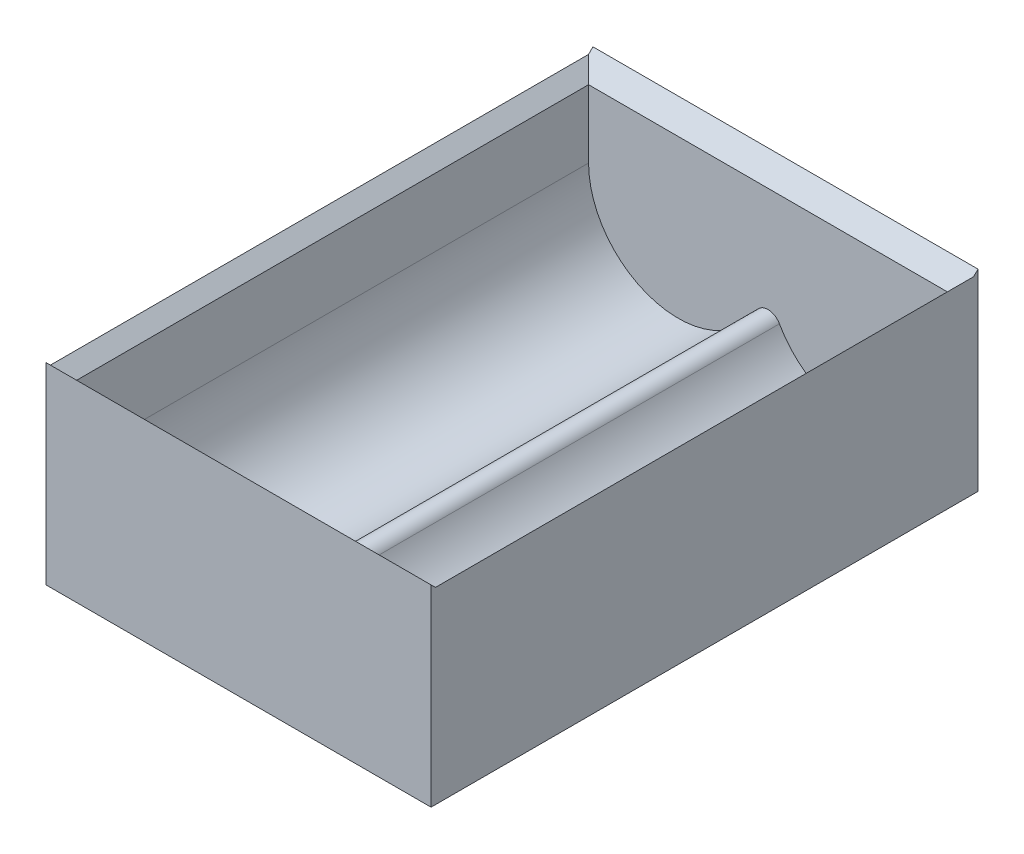
from build123d import *

# Parameters (mm, degrees)
SKETCH1_W           = 88
SKETCH1_H           = 125
BOSS_EXTRUDE1_DEPTH = 50
CUT_EXTRUDE1_DEPTH  = 117
FILLET1_R           = 3


with BuildPart() as part:
    # Sketch1 → Boss-Extrude1 (new body)
    with BuildSketch(Plane(origin=(0, 0, 0), x_dir=(1, 0, 0), z_dir=(0, 1, 0))):
        Rectangle(SKETCH1_W, SKETCH1_H)
    extrude(amount=BOSS_EXTRUDE1_DEPTH)

    # Sketch2 → Cut-Extrude1 (cut)
    with BuildSketch(Plane.XY.offset(58.5)):
        with BuildLine():
            Line((-41, 24.5), (-41, 66.5))
            Line((-41, 66.5), (41, 66.5))
            Line((41, 66.5), (41, 24.5))
            ThreePointArc((41, 24.5), (20.5, 4), (0, 24.5))
            ThreePointArc((0, 24.5), (-20.5, 4), (-41, 24.5))
        make_face()
    extrude(amount=-CUT_EXTRUDE1_DEPTH, mode=Mode.SUBTRACT)

    # Fillet1
    fillet1_edges = [part.edges().sort_by_distance(p)[0] for p in [
        (0, 24.5, 0),
    ]]
    fillet(fillet1_edges, radius=FILLET1_R)

    # Chamfer1
    # the kernel refuses this chamfer: 10 mm, written as the material it takes off along each edge
    with BuildSketch(Plane(origin=(-41, 50, 58.5), x_dir=(0, 0.027495876610586337, 0.9996219169112968), z_dir=(1, 0, 0)), Plane(origin=(-41, 50, -58.5), x_dir=(0, -0.9996219169112968, 0.027495876610586317), z_dir=(1, 0, 0))) as chamfer1_piece_1:
        with BuildLine():
            Line((10.286731952, 0), (-0.565471549, 10.271177935))
            Line((-0.565471549, 10.271177935), (-0.765395932, 10.26567876))
            ThreePointArc((-0.765395932, 10.26567876), (-0.341292271, 5.133978296), (-0.199924383, -0.005499175))
            Line((-0.199924383, -0.005499175), (0.005499175, -0.199924383))
            ThreePointArc((0.005499175, -0.199924383), (5.144976647, -0.058556496), (10.292231127, -0.199924383))
            Line((10.292231127, -0.199924383), (10.286731952, 0))
        make_face()
    extrude(amount=82, mode=Mode.SUBTRACT)
    with BuildSketch(Plane(origin=(41, 50, 58.5), x_dir=(0.9996219169112968, 0.027495876610586317, 0), z_dir=(0, 0, -1))) as chamfer1_piece_2:
        with BuildLine():
            Line((10.286731952, 0), (-0.565471549, 10.271177935))
            Line((-0.565471549, 10.271177935), (-0.765395932, 10.26567876))
            ThreePointArc((-0.765395932, 10.26567876), (-0.341292271, 5.133978296), (-0.199924383, -0.005499175))
            Line((-0.199924383, -0.005499175), (0.005499175, -0.199924383))
            ThreePointArc((0.005499175, -0.199924383), (5.144976647, -0.058556496), (10.292231127, -0.199924383))
            Line((10.292231127, -0.199924383), (10.286731952, 0))
        make_face()
    extrude(amount=117, mode=Mode.SUBTRACT)
    with BuildSketch(Plane(origin=(-41, 50, -58.5), x_dir=(0.027495876610586317, -0.9996219169112968, 0), z_dir=(0, 0, 1))) as chamfer1_piece_3:
        with BuildLine():
            Line((10.286731952, 0), (-0.565471549, -10.271177935))
            Line((-0.565471549, -10.271177935), (-0.765395932, -10.26567876))
            ThreePointArc((-0.765395932, -10.26567876), (-0.341292271, -5.133978296), (-0.199924383, 0.005499175))
            Line((-0.199924383, 0.005499175), (0.005499175, 0.199924383))
            ThreePointArc((0.005499175, 0.199924383), (5.144976647, 0.058556496), (10.292231127, 0.199924383))
            Line((10.292231127, 0.199924383), (10.286731952, 0))
        make_face()
    extrude(amount=117, mode=Mode.SUBTRACT)
    with BuildSketch(Plane(origin=(-41, 50, -58.5), x_dir=(0.027495876610586317, -0.9996219169112968, 0), z_dir=(0, 0, 1))) as chamfer1_piece_4a_section:
        with BuildLine():
            Line((10.286731952, 0), (-0.565471549, -10.271177935))
            Line((-0.565471549, -10.271177935), (-0.765395932, -10.26567876))
            ThreePointArc((-0.765395932, -10.26567876), (-0.341292271, -5.133978296), (-0.199924383, 0.005499175))
            Line((-0.199924383, 0.005499175), (0.005499175, 0.199924383))
            ThreePointArc((0.005499175, 0.199924383), (5.144976647, 0.058556496), (10.292231127, 0.199924383))
            Line((10.292231127, 0.199924383), (10.286731952, 0))
        make_face()
    chamfer1_piece_4a = extrude(amount=142.71682988, mode=Mode.PRIVATE)
    chamfer1_piece_4a = split(chamfer1_piece_4a, bisect_by=Plane(origin=(-44.297936268, 46.702063732, 58.5), z_dir=(0, 0, 1)), keep=Keep.TOP, mode=Mode.PRIVATE)
    with BuildSketch(Plane(origin=(-66.71682988, 50, 58.5), x_dir=(0, 0.027495876610586337, 0.9996219169112968), z_dir=(1, 0, 0))) as chamfer1_piece_4b_section:
        with BuildLine():
            Line((10.286731952, 0), (-0.565471549, 10.271177935))
            Line((-0.565471549, 10.271177935), (-0.765395932, 10.26567876))
            ThreePointArc((-0.765395932, 10.26567876), (-0.341292271, 5.133978296), (-0.199924383, -0.005499175))
            Line((-0.199924383, -0.005499175), (0.005499175, -0.199924383))
            ThreePointArc((0.005499175, -0.199924383), (5.144976647, -0.058556496), (10.292231127, -0.199924383))
            Line((10.292231127, -0.199924383), (10.286731952, 0))
        make_face()
    chamfer1_piece_4b = extrude(amount=107.71682988, mode=Mode.PRIVATE)
    chamfer1_piece_4b = split(chamfer1_piece_4b, bisect_by=Plane(origin=(-41, 46.702063732, 61.797936268), z_dir=(-1, 0, 0)), keep=Keep.TOP, mode=Mode.PRIVATE)
    chamfer1_piece_4 = chamfer1_piece_4a & chamfer1_piece_4b
    add(chamfer1_piece_4, mode=Mode.SUBTRACT)
    with BuildSketch(Plane(origin=(41, 50, 84.21682988), x_dir=(0.9996219169112968, 0.027495876610586317, 0), z_dir=(0, 0, -1))) as chamfer1_piece_5a_section:
        with BuildLine():
            Line((10.286731952, 0), (-0.565471549, 10.271177935))
            Line((-0.565471549, 10.271177935), (-0.765395932, 10.26567876))
            ThreePointArc((-0.765395932, 10.26567876), (-0.341292271, 5.133978296), (-0.199924383, -0.005499175))
            Line((-0.199924383, -0.005499175), (0.005499175, -0.199924383))
            ThreePointArc((0.005499175, -0.199924383), (5.144976647, -0.058556496), (10.292231127, -0.199924383))
            Line((10.292231127, -0.199924383), (10.286731952, 0))
        make_face()
    chamfer1_piece_5a = extrude(amount=142.71682988, mode=Mode.PRIVATE)
    chamfer1_piece_5a = split(chamfer1_piece_5a, bisect_by=Plane(origin=(44.297936268, 46.702063732, 58.5), z_dir=(0, 0, 1)), keep=Keep.TOP, mode=Mode.PRIVATE)
    with BuildSketch(Plane(origin=(-41, 50, 58.5), x_dir=(0, 0.027495876610586337, 0.9996219169112968), z_dir=(1, 0, 0))) as chamfer1_piece_5b_section:
        with BuildLine():
            Line((10.286731952, 0), (-0.565471549, 10.271177935))
            Line((-0.565471549, 10.271177935), (-0.765395932, 10.26567876))
            ThreePointArc((-0.765395932, 10.26567876), (-0.341292271, 5.133978296), (-0.199924383, -0.005499175))
            Line((-0.199924383, -0.005499175), (0.005499175, -0.199924383))
            ThreePointArc((0.005499175, -0.199924383), (5.144976647, -0.058556496), (10.292231127, -0.199924383))
            Line((10.292231127, -0.199924383), (10.286731952, 0))
        make_face()
    chamfer1_piece_5b = extrude(amount=107.71682988, mode=Mode.PRIVATE)
    chamfer1_piece_5b = split(chamfer1_piece_5b, bisect_by=Plane(origin=(41, 46.702063732, 61.797936268), z_dir=(1, 0, 0)), keep=Keep.TOP, mode=Mode.PRIVATE)
    chamfer1_piece_5 = chamfer1_piece_5a & chamfer1_piece_5b
    add(chamfer1_piece_5, mode=Mode.SUBTRACT)
    with BuildSketch(Plane(origin=(-41, 50, -58.5), x_dir=(0, -0.9996219169112968, 0.027495876610586317), z_dir=(1, 0, 0))) as chamfer1_piece_6a_section:
        with BuildLine():
            Line((10.286731952, 0), (-0.565471549, 10.271177935))
            Line((-0.565471549, 10.271177935), (-0.765395932, 10.26567876))
            ThreePointArc((-0.765395932, 10.26567876), (-0.341292271, 5.133978296), (-0.199924383, -0.005499175))
            Line((-0.199924383, -0.005499175), (0.005499175, -0.199924383))
            ThreePointArc((0.005499175, -0.199924383), (5.144976647, -0.058556496), (10.292231127, -0.199924383))
            Line((10.292231127, -0.199924383), (10.286731952, 0))
        make_face()
    chamfer1_piece_6a = extrude(amount=107.71682988, mode=Mode.PRIVATE)
    chamfer1_piece_6a = split(chamfer1_piece_6a, bisect_by=Plane(origin=(41, 46.702063732, -61.797936268), z_dir=(1, 0, 0)), keep=Keep.TOP, mode=Mode.PRIVATE)
    with BuildSketch(Plane(origin=(41, 50, 58.5), x_dir=(0.9996219169112968, 0.027495876610586317, 0), z_dir=(0, 0, -1))) as chamfer1_piece_6b_section:
        with BuildLine():
            Line((10.286731952, 0), (-0.565471549, 10.271177935))
            Line((-0.565471549, 10.271177935), (-0.765395932, 10.26567876))
            ThreePointArc((-0.765395932, 10.26567876), (-0.341292271, 5.133978296), (-0.199924383, -0.005499175))
            Line((-0.199924383, -0.005499175), (0.005499175, -0.199924383))
            ThreePointArc((0.005499175, -0.199924383), (5.144976647, -0.058556496), (10.292231127, -0.199924383))
            Line((10.292231127, -0.199924383), (10.286731952, 0))
        make_face()
    chamfer1_piece_6b = extrude(amount=142.71682988, mode=Mode.PRIVATE)
    chamfer1_piece_6b = split(chamfer1_piece_6b, bisect_by=Plane(origin=(44.297936268, 46.702063732, -58.5), z_dir=(0, 0, -1)), keep=Keep.TOP, mode=Mode.PRIVATE)
    chamfer1_piece_6 = chamfer1_piece_6a & chamfer1_piece_6b
    add(chamfer1_piece_6, mode=Mode.SUBTRACT)
    with BuildSketch(Plane(origin=(-66.71682988, 50, -58.5), x_dir=(0, -0.9996219169112968, 0.027495876610586317), z_dir=(1, 0, 0))) as chamfer1_piece_7a_section:
        with BuildLine():
            Line((10.286731952, 0), (-0.565471549, 10.271177935))
            Line((-0.565471549, 10.271177935), (-0.765395932, 10.26567876))
            ThreePointArc((-0.765395932, 10.26567876), (-0.341292271, 5.133978296), (-0.199924383, -0.005499175))
            Line((-0.199924383, -0.005499175), (0.005499175, -0.199924383))
            ThreePointArc((0.005499175, -0.199924383), (5.144976647, -0.058556496), (10.292231127, -0.199924383))
            Line((10.292231127, -0.199924383), (10.286731952, 0))
        make_face()
    chamfer1_piece_7a = extrude(amount=107.71682988, mode=Mode.PRIVATE)
    chamfer1_piece_7a = split(chamfer1_piece_7a, bisect_by=Plane(origin=(-41, 46.702063732, -61.797936268), z_dir=(-1, 0, 0)), keep=Keep.TOP, mode=Mode.PRIVATE)
    with BuildSketch(Plane(origin=(-41, 50, -84.21682988), x_dir=(0.027495876610586317, -0.9996219169112968, 0), z_dir=(0, 0, 1))) as chamfer1_piece_7b_section:
        with BuildLine():
            Line((10.286731952, 0), (-0.565471549, -10.271177935))
            Line((-0.565471549, -10.271177935), (-0.765395932, -10.26567876))
            ThreePointArc((-0.765395932, -10.26567876), (-0.341292271, -5.133978296), (-0.199924383, 0.005499175))
            Line((-0.199924383, 0.005499175), (0.005499175, 0.199924383))
            ThreePointArc((0.005499175, 0.199924383), (5.144976647, 0.058556496), (10.292231127, 0.199924383))
            Line((10.292231127, 0.199924383), (10.286731952, 0))
        make_face()
    chamfer1_piece_7b = extrude(amount=142.71682988, mode=Mode.PRIVATE)
    chamfer1_piece_7b = split(chamfer1_piece_7b, bisect_by=Plane(origin=(-44.297936268, 46.702063732, -58.5), z_dir=(0, 0, -1)), keep=Keep.TOP, mode=Mode.PRIVATE)
    chamfer1_piece_7 = chamfer1_piece_7a & chamfer1_piece_7b
    add(chamfer1_piece_7, mode=Mode.SUBTRACT)


solid = part.part
